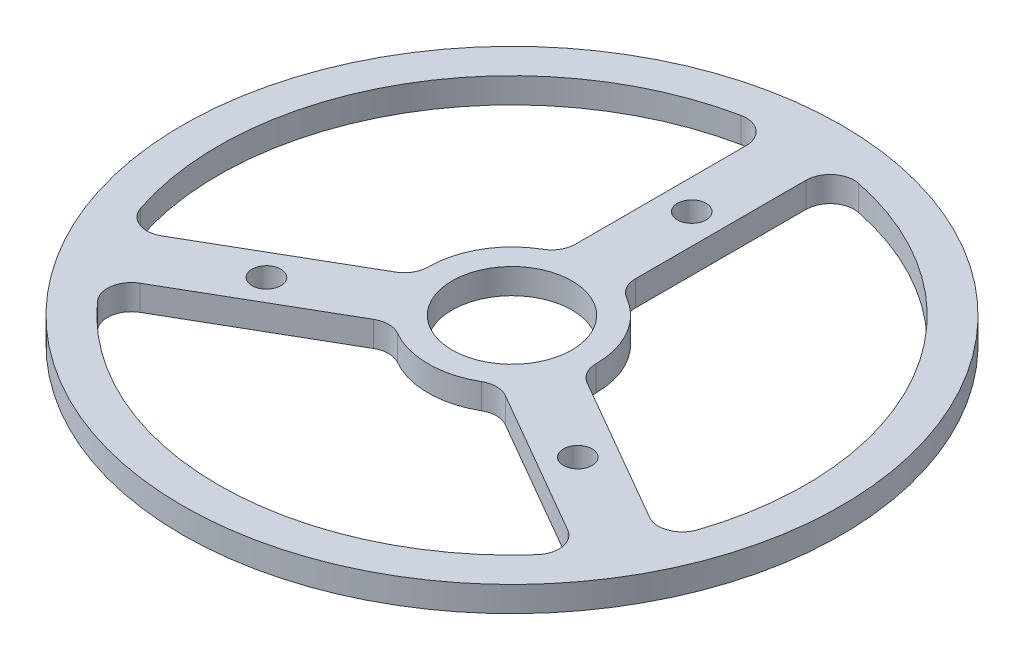
from build123d import *

# Parameters (mm, degrees)
CROQUIS1_R              = 27.5
SALIENTE_EXTRUIR1_DEPTH = 2.11
CROQUIS2_R              = 1.2
CROQUIS2_R_2            = 5
CORTAR_EXTRUIR1_DEPTH   = 39.948069272
REDONDEO1_R             = 2


with BuildPart() as part:
    # Croquis1 → Saliente-Extruir1 (new body)
    with BuildSketch(Plane(origin=(0, 0, 0), x_dir=(1, 0, 0), z_dir=(0, 1, 0))):
        Circle(CROQUIS1_R)
    extrude(amount=SALIENTE_EXTRUIR1_DEPTH)

    # Croquis2 → Cortar-Extruir1 (cut, through all)
    with BuildSketch(Plane(origin=(0, 2.11, 0), x_dir=(1, 0, 0), z_dir=(0, 1, 0))):
        with Locations((0, 15)):
            Circle(CROQUIS2_R)
        with Locations((12.990381057, -7.5)):
            Circle(CROQUIS2_R)
        with Locations((-12.990381057, -7.5)):
            Circle(CROQUIS2_R)
        Circle(CROQUIS2_R_2)
        with BuildLine():
            Line((-2.5, 6.538348415), (-2.5, 24.372115214))
            ThreePointArc((-2.5, 24.372115214), (-21.217622393, 12.25), (-22.356870919, -10.020994097))
            Line((-22.356870919, -10.020994097), (-6.912375826, -1.104110698))
            ThreePointArc((-6.912375826, -1.104110698), (-6.062177826, 3.5), (-2.5, 6.538348415))
        make_face()
        with BuildLine():
            Line((2.5, 6.538348415), (2.5, 24.372115214))
            ThreePointArc((2.5, 24.372115214), (21.217622393, 12.25), (22.356870919, -10.020994097))
            Line((22.356870919, -10.020994097), (6.912375826, -1.104110698))
            ThreePointArc((6.912375826, -1.104110698), (6.062177826, 3.5), (2.5, 6.538348415))
        make_face()
        with BuildLine():
            Line((4.412375826, -5.434237717), (19.856870919, -14.351121116))
            ThreePointArc((19.856870919, -14.351121116), (0, -24.5), (-19.856870919, -14.351121116))
            Line((-19.856870919, -14.351121116), (-4.412375826, -5.434237717))
            ThreePointArc((-4.412375826, -5.434237717), (0, -7), (4.412375826, -5.434237717))
        make_face()
    extrude(amount=-CORTAR_EXTRUIR1_DEPTH, mode=Mode.SUBTRACT)

    # Redondeo1
    redondeo1_edges = [part.edges().sort_by_distance(p)[0] for p in [
        (-4.412375826, 1.055, 5.434237717),
        (4.412375826, 1.055, 5.434237717),
        (6.912375826, 1.055, 1.104110698),
        (2.5, 1.055, -6.538348415),
        (-6.912375826, 1.055, 1.104110698),
        (-2.5, 1.055, -6.538348415),
        (-22.356870919, 1.055, 10.020994097),
        (-19.856870919, 1.055, 14.351121116),
        (19.856870919, 1.055, 14.351121116),
        (22.356870919, 1.055, 10.020994097),
        (-2.5, 1.055, -24.372115214),
        (2.5, 1.055, -24.372115214),
    ]]
    fillet(redondeo1_edges, radius=REDONDEO1_R)


solid = part.part
